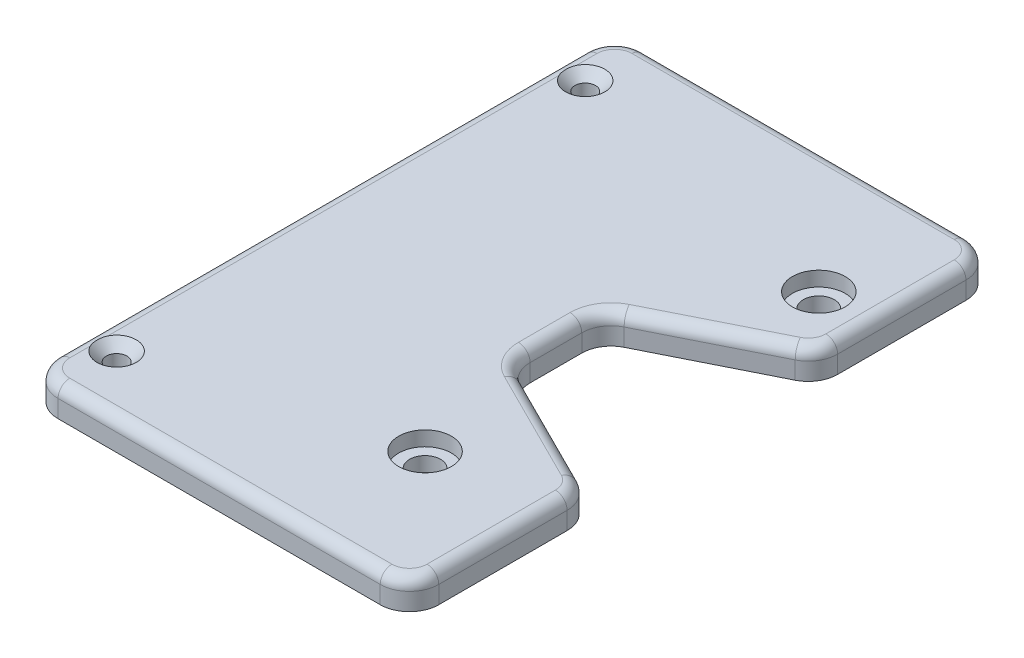
from build123d import *

# Parameters (mm, degrees)
SKETCH2_W           = 65
SKETCH2_H           = 100
SKETCH2_R           = 1.75
SKETCH2_R_2         = 2.65
BOSS_EXTRUDE1_DEPTH = 5
SKETCH3_R           = 4.5
CUT_EXTRUDE1_DEPTH  = 2.5
FILLET1_R           = 5
CHAMFER1_SIZE       = 1.6
CUT_EXTRUDE2_DEPTH  = 60.843546018
FILLET3_R           = 5
FILLET2_R           = 2


with BuildPart() as part:
    # Sketch2 → Boss-Extrude1 (new body)
    with BuildSketch(Plane(origin=(0, 0, 0), x_dir=(1, 0, 0), z_dir=(0, 1, 0))):
        Rectangle(SKETCH2_W, SKETCH2_H)
        with Locations(Location((-27.5, 40, 0), (0, 0, 270))):
            Circle(SKETCH2_R, mode=Mode.SUBTRACT)
        with Locations(Location((-27.5, -40, 0), (0, 0, 270))):
            Circle(SKETCH2_R, mode=Mode.SUBTRACT)
        with Locations(Location((23.6525, 28.725, 0), (0, 0, 270))):
            Circle(SKETCH2_R_2, mode=Mode.SUBTRACT)
        with Locations(Location((13.65, -28.4925, 0), (0, 0, 270))):
            Circle(SKETCH2_R_2, mode=Mode.SUBTRACT)
    extrude(amount=BOSS_EXTRUDE1_DEPTH)

    # Sketch3 → Cut-Extrude1 (cut)
    with BuildSketch(Plane(origin=(0, 5, 0), x_dir=(1, 0, 0), z_dir=(0, 1, 0))):
        with Locations(Location((23.6525, 28.725, 0), (0, 0, 270))):
            Circle(SKETCH3_R)
        with Locations(Location((13.65, -28.4925, 0), (0, 0, 270))):
            Circle(SKETCH3_R)
    extrude(amount=-CUT_EXTRUDE1_DEPTH, mode=Mode.SUBTRACT)

    # Fillet1
    fillet1_edges = [part.edges().sort_by_distance(p)[0] for p in [
        (32.5, 2.5, 50),
        (-32.5, 2.5, 50),
        (-32.5, 2.5, -50),
        (32.5, 2.5, -50),
    ]]
    fillet(fillet1_edges, radius=FILLET1_R)

    # Chamfer1
    chamfer1_edges = [part.edges().sort_by_distance(p)[0] for p in [
        (-27.5, 5, -41.75),
        (-27.5, 5, 38.25),
    ]]
    chamfer(chamfer1_edges, length=CHAMFER1_SIZE)

    # Sketch4 → Cut-Extrude2 (cut, through all)
    with BuildSketch(Plane(origin=(0, 5, 0), x_dir=(1, 0, 0), z_dir=(0, 1, 0))):
        Polygon((7.5, 7.5), (7.5, -7.5), (32.5, -20), (32.5, 20), align=None)
    extrude(amount=-CUT_EXTRUDE2_DEPTH, mode=Mode.SUBTRACT)

    # Fillet3
    fillet3_edges = [part.edges().sort_by_distance(p)[0] for p in [
        (7.5, 2.5, -7.5),
        (32.5, 2.5, -20),
        (32.5, 2.5, 20),
        (7.5, 2.5, 7.5),
    ]]
    fillet(fillet3_edges, radius=FILLET3_R)

    # Fillet2
    # the kernel refuses this fillet: 2 mm, written as the material it takes off along each edge
    with BuildSketch(Plane(origin=(12.5, 5, 4.409830056), x_dir=(-0.447213595499958, 0, 0.894427190999916), z_dir=(0.894427190999916, 0, 0.447213595499958))) as fillet2_piece_1:
        with BuildLine():
            CenterArc((5 + FILLET2_R, FILLET2_R), FILLET2_R, 180, 90)
            Line((5, FILLET2_R), (5, 0))
            Line((5, 0), (5 + FILLET2_R, 0))
        make_face()
    revolve(axis=Axis((12.5, 5, 4.409830056), (0, -1, 0)), revolution_arc=63.434948823, mode=Mode.SUBTRACT)
    with BuildSketch(Plane(origin=(12.5, 5, -4.409830056), x_dir=(-1, 0, 0), z_dir=(0, 0, 1))) as fillet2_piece_2:
        with BuildLine():
            CenterArc((5 + FILLET2_R, FILLET2_R), FILLET2_R, 180, 90)
            Line((5, FILLET2_R), (5, 0))
            Line((5, 0), (5 + FILLET2_R, 0))
        make_face()
    revolve(axis=Axis((12.5, 5, -4.409830056), (0, -1, 0)), revolution_arc=63.434948823, mode=Mode.SUBTRACT)
    with BuildSketch(Plane(origin=(32.5, 5, 23.090169944), x_dir=(-1, 0, 0), z_dir=(0, 0, 1)), Plane(origin=(32.5, 5, -45), x_dir=(-1, 0, 0), z_dir=(0, 0, 1))) as fillet2_piece_3:
        with BuildLine():
            CenterArc((FILLET2_R, FILLET2_R), FILLET2_R, 180, 90)
            Line((0, FILLET2_R), (0, 0))
            Line((0, 0), (FILLET2_R, 0))
        make_face()
    extrude(amount=21.909830056, mode=Mode.SUBTRACT)
    with BuildSketch(Plane(origin=(27.5, 5, 50), x_dir=(0, 0, -1), z_dir=(-1, 0, 0)), Plane(origin=(-27.5, 5, -50), x_dir=(0, 0, 1), z_dir=(1, 0, 0))) as fillet2_piece_4:
        with BuildLine():
            CenterArc((FILLET2_R, FILLET2_R), FILLET2_R, 180, 90)
            Line((0, FILLET2_R), (0, 0))
            Line((0, 0), (FILLET2_R, 0))
        make_face()
    extrude(amount=55, mode=Mode.SUBTRACT)
    with BuildSketch(Plane(origin=(-32.5, 5, 45), x_dir=(1, 0, 0), z_dir=(0, 0, -1))) as fillet2_piece_5:
        with BuildLine():
            CenterArc((FILLET2_R, FILLET2_R), FILLET2_R, 180, 90)
            Line((0, FILLET2_R), (0, 0))
            Line((0, 0), (FILLET2_R, 0))
        make_face()
    extrude(amount=90, mode=Mode.SUBTRACT)
    with BuildSketch(Plane(origin=(-27.5, 5, 45), x_dir=(-1, 0, 0), z_dir=(0, 0, -1))) as fillet2_piece_6:
        with BuildLine():
            CenterArc((5 - FILLET2_R, -FILLET2_R), FILLET2_R, 0, 90)
            Line((5, -FILLET2_R), (5, 0))
            Line((5, 0), (5 - FILLET2_R, 0))
        make_face()
    revolve(axis=Axis((-27.5, 5, 45), (0, 1, 0)), revolution_arc=90, mode=Mode.SUBTRACT)
    with BuildSketch(Plane(origin=(27.5, 5, -45), x_dir=(0, 0, -1), z_dir=(-1, 0, 0))) as fillet2_piece_7:
        with BuildLine():
            CenterArc((5 - FILLET2_R, FILLET2_R), FILLET2_R, 270, 90)
            Line((5, FILLET2_R), (5, 0))
            Line((5, 0), (5 - FILLET2_R, 0))
        make_face()
    revolve(axis=Axis((27.5, 5, -45), (0, -1, 0)), revolution_arc=90, mode=Mode.SUBTRACT)
    with BuildSketch(Plane(origin=(-27.5, 5, -45), x_dir=(0, 0, -1), z_dir=(1, 0, 0))) as fillet2_piece_8:
        with BuildLine():
            CenterArc((5 - FILLET2_R, -FILLET2_R), FILLET2_R, 0, 90)
            Line((5, -FILLET2_R), (5, 0))
            Line((5, 0), (5 - FILLET2_R, 0))
        make_face()
    revolve(axis=Axis((-27.5, 5, -45), (0, 1, 0)), revolution_arc=90, mode=Mode.SUBTRACT)
    with BuildSketch(Plane(origin=(27.5, 5, 45), x_dir=(1, 0, 0), z_dir=(0, 0, -1))) as fillet2_piece_9:
        with BuildLine():
            CenterArc((5 - FILLET2_R, FILLET2_R), FILLET2_R, 270, 90)
            Line((5, FILLET2_R), (5, 0))
            Line((5, 0), (5 - FILLET2_R, 0))
        make_face()
    revolve(axis=Axis((27.5, 5, 45), (0, -1, 0)), revolution_arc=90, mode=Mode.SUBTRACT)
    with BuildSketch(Plane(origin=(29.736067977, 5, -18.618033989), x_dir=(-0.4472135954999579, 0, -0.8944271909999159), z_dir=(-0.894427190999916, 0, 0.4472135954999579)), Plane(origin=(10.263932023, 5, 8.881966011), x_dir=(-0.4472135954999579, 0, 0.894427190999916), z_dir=(0.894427190999916, 0, 0.4472135954999579))) as fillet2_piece_10:
        with BuildLine():
            CenterArc((FILLET2_R, FILLET2_R), FILLET2_R, 180, 90)
            Line((0, FILLET2_R), (0, 0))
            Line((0, 0), (FILLET2_R, 0))
        make_face()
    extrude(amount=21.770509831, mode=Mode.SUBTRACT)
    with BuildSketch(Plane(origin=(7.5, 5, -4.409830056), x_dir=(-1, 0, 0), z_dir=(0, 0, 1))) as fillet2_piece_11:
        with BuildLine():
            CenterArc((FILLET2_R, FILLET2_R), FILLET2_R, 180, 90)
            Line((0, FILLET2_R), (0, 0))
            Line((0, 0), (FILLET2_R, 0))
        make_face()
    extrude(amount=8.819660113, mode=Mode.SUBTRACT)
    with BuildSketch(Plane(origin=(27.5, 5, 23.090169944), x_dir=(1, 0, 0), z_dir=(0, 0, 1))) as fillet2_piece_12:
        with BuildLine():
            CenterArc((5 - FILLET2_R, -FILLET2_R), FILLET2_R, 0, 90)
            Line((5, -FILLET2_R), (5, 0))
            Line((5, 0), (5 - FILLET2_R, 0))
        make_face()
    revolve(axis=Axis((27.5, 5, 23.090169944), (0, 1, 0)), revolution_arc=63.434948823, mode=Mode.SUBTRACT)
    with BuildSketch(Plane(origin=(27.5, 5, -23.090169944), x_dir=(0.44721359549995743, 0, 0.8944271909999162), z_dir=(-0.8944271909999162, 0, 0.44721359549995743))) as fillet2_piece_13:
        with BuildLine():
            CenterArc((5 - FILLET2_R, -FILLET2_R), FILLET2_R, 0, 90)
            Line((5, -FILLET2_R), (5, 0))
            Line((5, 0), (5 - FILLET2_R, 0))
        make_face()
    revolve(axis=Axis((27.5, 5, -23.090169944), (0, 1, 0)), revolution_arc=63.434948823, mode=Mode.SUBTRACT)


solid = part.part
